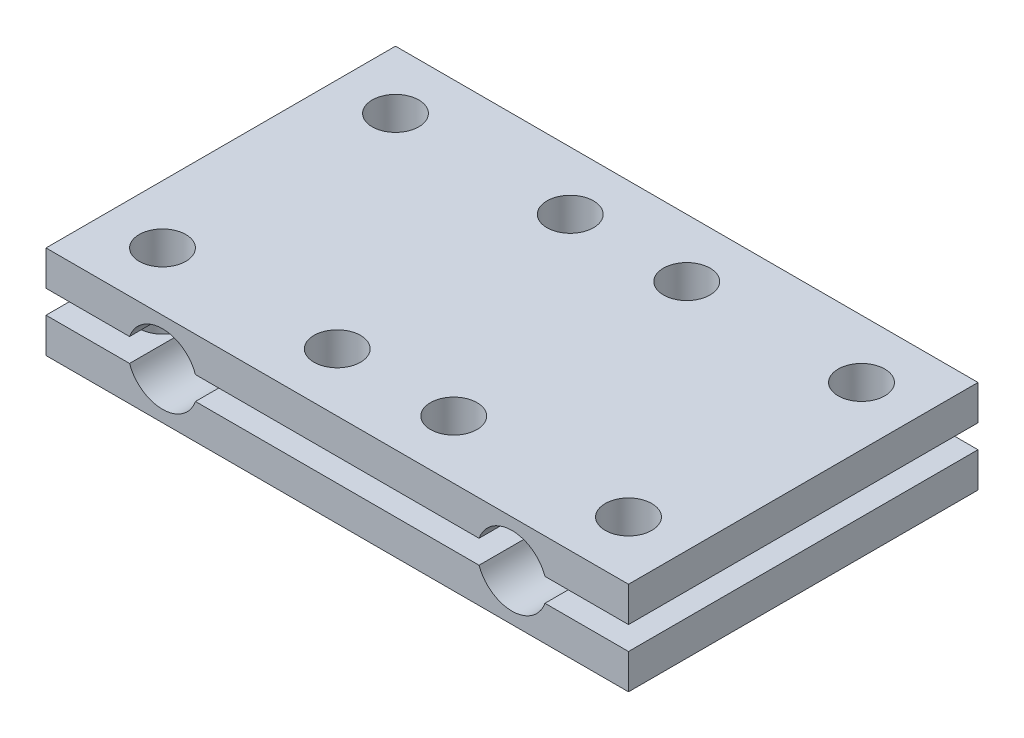
from build123d import *

# Parameters (mm, degrees)
SKETCH_1_W          = 50
SKETCH_1_H          = 30
SKETCH_1_R          = 2
EXTRUDE_1_DEPTH     = 8
CUT_EXTRUDE_1_DEPTH = 40.862262856


with BuildPart() as part:
    # 스케치1 → 보스-돌출1 (new body)
    with BuildSketch(Plane(origin=(0, 0, 0), x_dir=(1, 0, 0), z_dir=(0, 1, 0))):
        with Locations((0, 15)):
            Rectangle(SKETCH_1_W, SKETCH_1_H)
        with Locations((5, 5)):
            Circle(SKETCH_1_R, mode=Mode.SUBTRACT)
        with Locations((20, 5)):
            Circle(SKETCH_1_R, mode=Mode.SUBTRACT)
        with Locations((5, 25)):
            Circle(SKETCH_1_R, mode=Mode.SUBTRACT)
        with Locations((20, 25)):
            Circle(SKETCH_1_R, mode=Mode.SUBTRACT)
        with Locations((-5, 25)):
            Circle(SKETCH_1_R, mode=Mode.SUBTRACT)
        with Locations((-20, 5)):
            Circle(SKETCH_1_R, mode=Mode.SUBTRACT)
        with Locations((-5, 5)):
            Circle(SKETCH_1_R, mode=Mode.SUBTRACT)
        with Locations((-20, 25)):
            Circle(SKETCH_1_R, mode=Mode.SUBTRACT)
    extrude(amount=EXTRUDE_1_DEPTH)

    # 스케치2 → 컷-돌출1 (cut, through all)
    with BuildSketch(Plane.XY):
        with BuildLine():
            Line((-17.828427125, 5), (-25, 5))
            Line((-25, 5), (-25, 3))
            Line((-25, 3), (-17.828427125, 3))
            ThreePointArc((-17.828427125, 3), (-15, 1), (-12.171572875, 3))
            Line((-12.171572875, 3), (12.171572875, 3))
            ThreePointArc((12.171572875, 3), (15, 1), (17.828427125, 3))
            Line((17.828427125, 3), (25, 3))
            Line((25, 3), (25, 5))
            Line((25, 5), (17.828427125, 5))
            ThreePointArc((17.828427125, 5), (15, 7), (12.171572875, 5))
            Line((12.171572875, 5), (-12.171572875, 5))
            ThreePointArc((-12.171572875, 5), (-15, 7), (-17.828427125, 5))
        make_face()
    extrude(amount=-CUT_EXTRUDE_1_DEPTH, mode=Mode.SUBTRACT)


with BuildPart() as cut_extrude_1_piece_1:
    # of the separate pieces the step leaves, piece 1, a body of its own (cut_extrude_1_pieces)
    add(part.part.solids().sort_by_distance((25, 0, 0))[0])


with BuildPart() as cut_extrude_1_piece_2:
    # of the separate pieces the step leaves, piece 2, a body of its own (cut_extrude_1_pieces)
    add(part.part.solids().sort_by_distance((25, 5, 0))[0])


solid = Compound([cut_extrude_1_piece_1.part, cut_extrude_1_piece_2.part])
